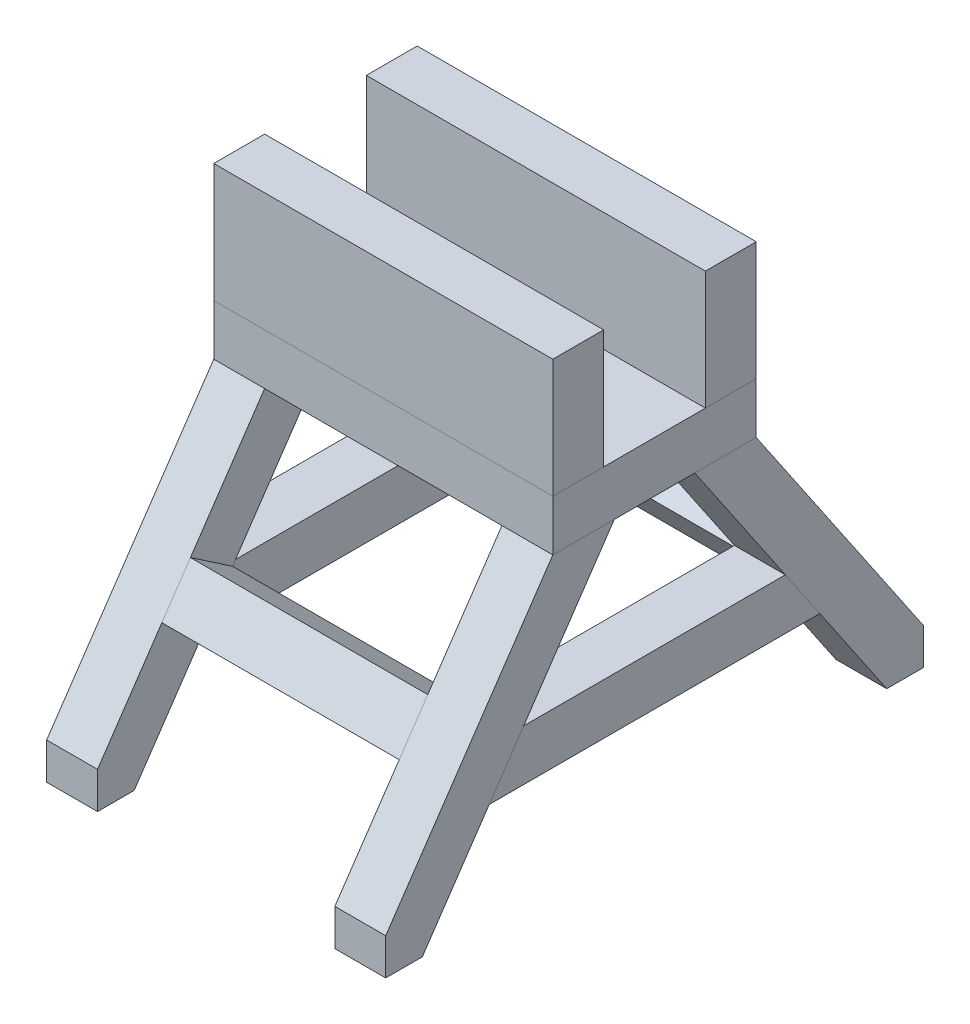
from build123d import *

# Parameters (mm, degrees)
SKETCH5_W             = 254
SKETCH5_H             = 152.4
BOSS_EXTRUDE4_DEPTH   = 38.1
BOSS_EXTRUDE3_DEPTH   = 38.1
BOSS_EXTRUDE5_DEPTH   = 254
SKETCH9_W             = 18.614651573
SKETCH9_H             = 27.430074188
CUT_EXTRUDE1_DEPTH    = 405
SPLIT1_OUTLINE_W      = 254
SPLIT1_OUTLINE_H      = 152.4
SPLIT1_DEPTH          = 38.1
SPLIT1_START          = -127
SPLIT1_2_DEPTH        = 38.1
SPLIT1_START_2        = 88.9
SPLIT1_3_DEPTH        = 38.1
SPLIT1_4_DEPTH        = 254
SPLIT1_5_DEPTH        = 254
SPLIT1_6_DEPTH        = 38.1
SPLIT1_7_DEPTH        = 38.1
SPLIT2_START          = -88.9
SPLIT2_DEPTH          = 177.8
SPLIT2_2_DEPTH        = 215.9
SPLIT2_START_2        = 88.9
SPLIT2_3_DEPTH        = 38.1
SPLIT2_4_DEPTH        = 177.8
SPLIT2_START_3        = -127
SPLIT2_5_DEPTH        = 38.1
SPLIT2_6_DEPTH        = 215.9
SKETCH10_W            = 38.1
SKETCH10_H            = 88.9
BOSS_EXTRUDE6_DEPTH   = 254
BOSS_EXTRUDE6_2_DEPTH = 254


# Read off the part's stored shape, not the designer's step: Split1, Split2
with BuildPart() as part:
    # Sketch5 → Boss-Extrude4 (new body)
    with BuildSketch(Plane(origin=(0, 0, 0), x_dir=(1, 0, 0), z_dir=(0, 1, 0))):
        Rectangle(SKETCH5_W, SKETCH5_H)
    extrude(amount=BOSS_EXTRUDE4_DEPTH)


with BuildPart() as body_2:
    # Sketch4 → Boss-Extrude3 (new body)
    with BuildSketch(Plane(origin=(127, 0, 0), x_dir=(0, 0, -1), z_dir=(1, 0, 0))):
        Polygon((0, 38.1), (-50.344502124, 38.1), (-220, -211.9), (-173.955274239, -211.9), (-123.872971266, -138.1), (0, -138.1), (0, -100), (-98.017473389, -100), (-30.155274239, 0), (0, 0), align=None)
    extrude(amount=-BOSS_EXTRUDE3_DEPTH)


with BuildPart() as body_3:
    # Mirror1: mirrored copy
    add(body_2.part.mirror(Plane(origin=(88.9, 0, 0), x_dir=(1, 0, 0), z_dir=(0, 0, -1))))


with BuildPart() as body_4:
    # Mirror2: mirrored copy
    add(body_3.part.mirror(Plane(origin=(0, 0, 0), x_dir=(0, 0, 1), z_dir=(1, 0, 0))))


with BuildPart() as body_5:
    # Mirror2 2: mirrored copy
    add(body_2.part.mirror(Plane(origin=(0, 0, 0), x_dir=(0, 0, 1), z_dir=(1, 0, 0))))


with BuildPart() as body_2_1:
    add(body_2.part)

    add(body_3.part)  # Boss-Extrude5 merges body 3

    add(body_4.part)  # Boss-Extrude5 merges body 4

    add(body_5.part)  # Boss-Extrude5 merges body 5
    # Sketch6 → Boss-Extrude5 (add)
    with BuildSketch(Plane(origin=(127, 0, 0), x_dir=(0, 0, -1), z_dir=(1, 0, 0))):
        Polygon((-131.774160921, -81.89266133), (-153.16845642, -113.418747673), (-121.642370077, -134.813043172), (-100.248074578, -103.286956828), align=None)
        Polygon((131.774160921, -81.89266133), (153.16845642, -113.418747673), (121.642370077, -134.813043172), (100.248074578, -103.286956828), align=None)
    extrude(amount=-BOSS_EXTRUDE5_DEPTH)


with BuildPart() as part_1:
    add(part.part)

    # Combine1: union body 2
    add(body_2_1.part)

    # Sketch9 → Cut-Extrude1 (cut)
    with BuildSketch(Plane.ZY.offset(127)):
        with Locations((-210.692674214, -198.184962906)):
            Rectangle(SKETCH9_W, SKETCH9_H)
        with Locations((210.692674214, -198.184962906)):
            Rectangle(SKETCH9_W, SKETCH9_H)
    extrude(amount=-CUT_EXTRUDE1_DEPTH, mode=Mode.SUBTRACT)

    # Split1 4 outline → Split1 4 (cut)
    with BuildSketch(Plane.YZ.offset(SPLIT1_START)):
        Polygon((38.1, 76.2), (0, 76.2), (0, -30.155274239), (-100, -98.017473389), (-100, 98.017473389), (-138.1, 123.872971266), (-138.1, -123.872971266), (-211.9, -173.955274239), (-211.9, -201.385348427), (-184.469925812, -201.385348427), (0, -76.2), (38.1, -76.2), align=None)
    extrude(amount=SPLIT1_4_DEPTH, mode=Mode.SUBTRACT)

    # Split2 2 outline → Split2 2 (cut)
    with BuildSketch(Plane.YZ.offset(SPLIT2_START)):
        Polygon((0, 30.155274239), (0, 76.2), (-184.469925812, 201.385348427), (-211.9, 201.385348427), (-211.9, 173.955274239), align=None)
    extrude(amount=SPLIT2_2_DEPTH, mode=Mode.SUBTRACT)


with BuildPart() as body_2_2:
    # Split1 outline → Split1 (new body)
    with BuildSketch(Plane(origin=(0, 0, 0), x_dir=(1, 0, 0), z_dir=(0, 1, 0))):
        Rectangle(SPLIT1_OUTLINE_W, SPLIT1_OUTLINE_H)
    extrude(amount=SPLIT1_DEPTH)


with BuildPart() as body_3_2:
    # Split1 2 outline → Split1 2 (new body)
    with BuildSketch(Plane.YZ.offset(SPLIT1_START)):
        Polygon((-138.1, -123.872971266), (-100, -98.017473389), (-100, 98.017473389), (-138.1, 123.872971266), align=None)
    extrude(amount=SPLIT1_2_DEPTH)


with BuildPart() as body_4_2:
    # Split1 3 outline → Split1 3 (new body)
    with BuildSketch(Plane.YZ.offset(SPLIT1_START_2)):
        Polygon((-138.1, -123.872971266), (-100, -98.017473389), (-100, 98.017473389), (-138.1, 123.872971266), align=None)
    extrude(amount=SPLIT1_3_DEPTH)


with BuildPart() as body_5_2:
    # Split1 5 outline → Split1 5 (new body)
    with BuildSketch(Plane.YZ.offset(SPLIT1_START)):
        Polygon((-81.89266133, -131.774160921), (-103.286956828, -100.248074578), (-134.813043172, -121.642370077), (-113.418747673, -153.16845642), align=None)
    extrude(amount=SPLIT1_5_DEPTH)

    # Split1 6 outline → Split1 6 (add)
    with BuildSketch(Plane.YZ.offset(SPLIT1_START)):
        Polygon((0, -76.2), (0, -30.155274239), (-103.286956828, -100.248074578), (-81.89266133, -131.774160921), align=None)
        Polygon((-113.418747673, -153.16845642), (-134.813043172, -121.642370077), (-211.9, -173.955274239), (-211.9, -201.385348427), (-184.469925812, -201.385348427), align=None)
    extrude(amount=SPLIT1_6_DEPTH)

    # Split1 7 outline → Split1 7 (add)
    with BuildSketch(Plane.YZ.offset(SPLIT1_START_2)):
        Polygon((0, -76.2), (0, -30.155274239), (-103.286956828, -100.248074578), (-81.89266133, -131.774160921), align=None)
        Polygon((-113.418747673, -153.16845642), (-134.813043172, -121.642370077), (-211.9, -173.955274239), (-211.9, -201.385348427), (-184.469925812, -201.385348427), align=None)
    extrude(amount=SPLIT1_7_DEPTH)

    # Split2 6 outline → Split2 6 (cut)
    with BuildSketch(Plane.YZ.offset(SPLIT2_START_3)):
        Polygon((0, -76.2), (0, -30.155274239), (-211.9, -173.955274239), (-211.9, -201.385348427), (-184.469925812, -201.385348427), align=None)
    extrude(amount=SPLIT2_6_DEPTH, mode=Mode.SUBTRACT)


with BuildPart() as body_6:
    # Split2 outline → Split2 (new body)
    with BuildSketch(Plane.YZ.offset(SPLIT2_START)):
        Polygon((-103.286956828, 100.248074578), (-81.89266133, 131.774160921), (-113.418747673, 153.16845642), (-134.813043172, 121.642370077), align=None)
    extrude(amount=SPLIT2_DEPTH)


with BuildPart() as body_7:
    # Split2 3 outline → Split2 3 (new body)
    with BuildSketch(Plane.YZ.offset(SPLIT2_START_2)):
        Polygon((-184.469925812, 201.385348427), (-211.9, 201.385348427), (-211.9, 173.955274239), (0, 30.155274239), (0, 76.2), align=None)
    extrude(amount=SPLIT2_3_DEPTH)


with BuildPart() as body_8:
    # Split2 4 outline → Split2 4 (new body)
    with BuildSketch(Plane.YZ.offset(SPLIT2_START)):
        Polygon((-134.813043172, -121.642370077), (-113.418747673, -153.16845642), (-81.89266133, -131.774160921), (-103.286956828, -100.248074578), align=None)
    extrude(amount=SPLIT2_4_DEPTH)


with BuildPart() as body_9:
    # Split2 5 outline → Split2 5 (new body)
    with BuildSketch(Plane.YZ.offset(SPLIT2_START_3)):
        Polygon((0, -76.2), (0, -30.155274239), (-211.9, -173.955274239), (-211.9, -201.385348427), (-184.469925812, -201.385348427), align=None)
    extrude(amount=SPLIT2_5_DEPTH)


with BuildPart() as body_10:
    # Sketch10 → Boss-Extrude6 (new body)
    with BuildSketch(Plane(origin=(127, 0, 0), x_dir=(0, 0, -1), z_dir=(1, 0, 0))):
        with Locations((-57.15, 82.55)):
            Rectangle(SKETCH10_W, SKETCH10_H)
    extrude(amount=-BOSS_EXTRUDE6_DEPTH)


with BuildPart() as body_11:
    # Sketch10 → Boss-Extrude6 2 (new body)
    with BuildSketch(Plane(origin=(127, 0, 0), x_dir=(0, 0, -1), z_dir=(1, 0, 0))):
        with Locations((57.15, 82.55)):
            Rectangle(SKETCH10_W, SKETCH10_H)
    extrude(amount=-BOSS_EXTRUDE6_2_DEPTH)


solid = Compound([part_1.part, body_2_2.part, body_3_2.part, body_4_2.part, body_5_2.part, body_6.part, body_7.part, body_8.part, body_9.part, body_10.part, body_11.part])
